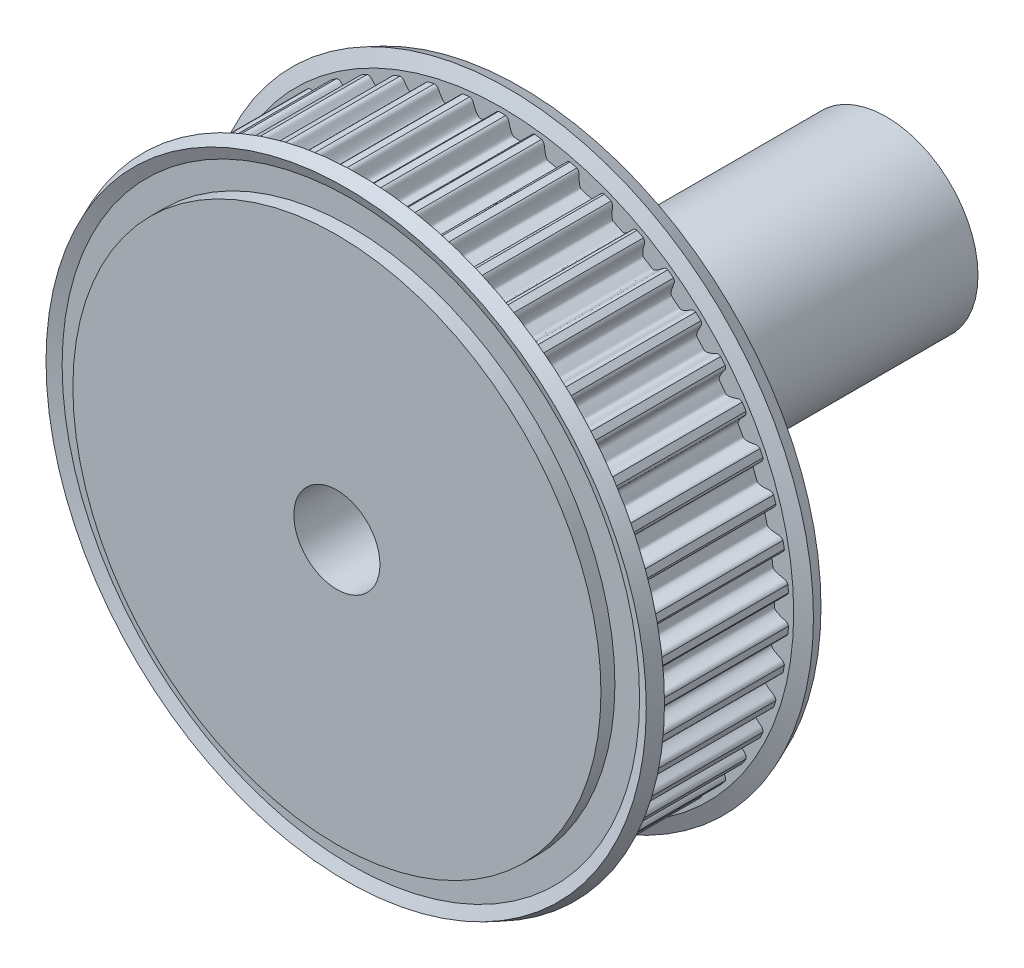
from build123d import *

# Parameters (mm, degrees)
TOOTHEXTRUDECUTGEARBELT01_DEPTH = 3.749999944
TOOTH_PATTERN_50_COUNT          = 50
BOREREVOLVESKETCH_W             = 10.547999842
BOREREVOLVESKETCH_H             = 5
SKETCH_5_R                      = 5
EXTRUDE_1_DEPTH                 = 10
SKETCH_6_R                      = 5
SKETCH_6_R_2                    = 2.5
EXTRUDE_2_DEPTH                 = 20
CUT_EXTRUDE_START               = -20
SKETCH_7_R                      = 2.5
CUT_EXTRUDE_2_DEPTH             = 20
CUT_EXTRUDE_3_DEPTH             = 20
SKETCH_9_R                      = 2.5
SKETCH_9_R_2                    = 2.35
EXTRUDE_3_DEPTH                 = 11
SKETCH_10_R                     = 2
CUT_EXTRUDE_4_DEPTH             = 11
SKETCH_12_R                     = 2
CUT_EXTRUDE_7_DEPTH             = 11


with BuildPart() as part:
    # SketchRevolveGearBelt01 → Gates_PowerGrip_GT_2mm, 6mm Belt Width (revolve)
    with BuildSketch(Plane(origin=(0, 0, 0), x_dir=(0, 0, -1), z_dir=(1, 0, 0))):
        Polygon((5.273999921, 0), (5.273999921, 14.415494093), (4.511999932, 14.415494093), (4.511999932, 15.763922848), (4.769626867, 16.385889288), (4.065630673, 16.677494059), (3.749999944, 15.91549407), (3.749999944, 15.646678254), (-3.749999944, 15.646678254), (-3.749999944, 15.91549407), (-4.065630673, 16.677494059), (-4.769626867, 16.385889288), (-4.511999932, 15.763922848), (-4.511999932, 14.415494093), (-5.273999921, 14.415494093), (-5.273999921, 0), align=None)
    revolve(axis=Axis((0, 0, 0), (0, 0, -1)))

    # SketchToothGearBelt01 → ToothExtrudeCutGearBelt01 (cut, symmetric)
    with BuildSketch(Plane.XY):
        with BuildLine():
            ThreePointArc((15.637376203, 0.861113256), (15.661067988, 0), (15.637376203, -0.861113256))
            add(Edge.make_bspline(
                [(15.637376203, -0.861113256), (15.637278933, -0.843918089), (15.634621947, -0.818141351), (15.626182662, -0.784761006), (15.61746536, -0.760453955), (15.606441353, -0.737102384), (15.593213806, -0.714924513), (15.577906271, -0.694127888), (15.560662121, -0.674906068), (15.541641534, -0.657441892), (15.521026112, -0.641886841), (15.498994385, -0.628430261), (15.475805238, -0.617033961), (15.434818262, -0.602515119), (15.382846813, -0.586823891), (15.321682454, -0.567481163), (15.269233172, -0.549825674), (15.219953565, -0.532186902), (15.173849403, -0.514546567), (15.130918186, -0.496909289), (15.091159139, -0.479273963), (15.05457066, -0.461640694), (15.02115084, -0.444008949), (14.990897185, -0.426377751), (14.963806669, -0.408745201), (14.939875464, -0.391107907), (14.91910027, -0.373460068), (14.901476198, -0.355792311), (14.887009705, -0.33809054), (14.875688939, -0.320336691), (14.867603066, -0.302512788), (14.862562303, -0.28461649), (14.860361058, -0.250312541), (14.863543325, -0.199994192), (14.86368738, -0.1333067), (14.864455912, -0.066656855), (14.864569984, 0), (14.864455912, 0.066656855), (14.86368738, 0.1333067), (14.863543325, 0.199994192), (14.860361058, 0.250312541), (14.862562303, 0.28461649), (14.867603066, 0.302512788), (14.875688939, 0.320336691), (14.887009705, 0.33809054), (14.901476198, 0.355792311), (14.91910027, 0.373460068), (14.939875464, 0.391107907), (14.963806669, 0.408745201), (14.990897185, 0.426377751), (15.02115084, 0.444008949), (15.05457066, 0.461640694), (15.091159139, 0.479273963), (15.130918186, 0.496909289), (15.173849403, 0.514546567), (15.219953565, 0.532186902), (15.269233172, 0.549825674), (15.321682454, 0.567481163), (15.382846813, 0.586823891), (15.434818262, 0.602515119), (15.475805238, 0.617033961), (15.498994385, 0.628430261), (15.521026112, 0.641886841), (15.541641534, 0.657441892), (15.560662121, 0.674906068), (15.577906271, 0.694127888), (15.593213806, 0.714924513), (15.606441353, 0.737102384), (15.61746536, 0.760453955), (15.626182662, 0.784761006), (15.634621947, 0.818141351), (15.637278933, 0.843918089), (15.637376203, 0.861113256)],
                knots=[0, 0, 0, 0, 0.019648851, 0.029473277, 0.039297703, 0.049122128, 0.058946554, 0.068770979, 0.078595405, 0.088419831, 0.098244256, 0.108068682, 0.117893108, 0.127717533, 0.157725567, 0.17996059, 0.201044693, 0.220984987, 0.239789879, 0.257469398, 0.274035615, 0.289503209, 0.303890223, 0.317219086, 0.329518021, 0.340822965, 0.351180206, 0.360649943, 0.369310898, 0.37726584, 0.38464709, 0.391619702, 0.398378739, 0.423802869, 0.449201913, 0.474600956, 0.5, 0.525399044, 0.550798087, 0.576197131, 0.601621261, 0.608380298, 0.61535291, 0.62273416, 0.630689102, 0.639350057, 0.648819794, 0.659177035, 0.670481979, 0.682780914, 0.696109777, 0.710496791, 0.725964385, 0.742530602, 0.760210121, 0.779015013, 0.798955307, 0.82003941, 0.842274433, 0.872282467, 0.882106892, 0.891931318, 0.901755744, 0.911580169, 0.921404595, 0.931229021, 0.941053446, 0.950877872, 0.960702297, 0.970526723, 0.980351149, 1, 1, 1, 1], degree=3))
        make_face()
    toothextrudecutgearbelt01 = extrude(amount=TOOTHEXTRUDECUTGEARBELT01_DEPTH, both=True, mode=Mode.SUBTRACT)

    # Tooth Pattern, 50: ToothExtrudeCutGearBelt01 ×50 about axis
    tooth_pattern_50_axis = Axis((0, 0, 55), (0, 0, -1))
    for i in range(1, TOOTH_PATTERN_50_COUNT):
        add(toothextrudecutgearbelt01.rotate(tooth_pattern_50_axis, i * 360 / TOOTH_PATTERN_50_COUNT), mode=Mode.SUBTRACT)

    # BoreRevolveSketch → BoreRevolveCut (revolve, cut)
    with BuildSketch(Plane(origin=(0, 0, 0), x_dir=(0, 0, -1), z_dir=(1, 0, 0))):
        with Locations((0, 2.5)):
            Rectangle(BOREREVOLVESKETCH_W, BOREREVOLVESKETCH_H)
    revolve(axis=Axis((0, 0, 0), (0, 0, -1)), mode=Mode.SUBTRACT)

    # 草图5 → 凸台-拉伸1 (add)
    with BuildSketch(Plane.XY.offset(5.273999921)):
        Circle(SKETCH_5_R)
    extrude(amount=-EXTRUDE_1_DEPTH)

    # 草图6 → 凸台-拉伸2 (add)
    with BuildSketch(Plane(origin=(0, 0, -4.726000079), x_dir=(-1, 0, 0), z_dir=(0, 0, -1))):
        Circle(SKETCH_6_R)
        Circle(SKETCH_6_R_2, mode=Mode.SUBTRACT)
    extrude(amount=EXTRUDE_2_DEPTH)

    # 草图7 → 切除-拉伸2 (cut)
    with BuildSketch(Plane(origin=(0, 0, -4.726000079), x_dir=(-1, 0, 0), z_dir=(0, 0, -1)).offset(CUT_EXTRUDE_START)):
        Circle(SKETCH_7_R)
    extrude(amount=CUT_EXTRUDE_2_DEPTH, mode=Mode.SUBTRACT)

    # 草图8 → 切除-拉伸3 (cut)
    with BuildSketch(Plane(origin=(0, 0, 0), x_dir=(1, 0, 0), z_dir=(0, 1, 0))):
        with BuildLine():
            ThreePointArc((0, 16.226000079), (-1.060660172, 13.665339907), (1.5, 14.726000079))
            ThreePointArc((1.5, 14.726000079), (1.060660172, 15.786660251), (0, 16.226000079))
        make_face()
    extrude(amount=-CUT_EXTRUDE_3_DEPTH, mode=Mode.SUBTRACT)

    # 草图9 → 凸台-拉伸3 (add)
    with BuildSketch(Plane.XY.offset(5.273999921)):
        Circle(SKETCH_9_R)
        Circle(SKETCH_9_R_2, mode=Mode.SUBTRACT)
    extrude(amount=-EXTRUDE_3_DEPTH)

    # 草图10 → 切除-拉伸4 (cut)
    with BuildSketch(Plane(origin=(0, 0, 0), x_dir=(0, 0, -1), z_dir=(1, 0, 0))):
        with Locations((14.726000079, 0)):
            Circle(SKETCH_10_R)
    extrude(amount=-CUT_EXTRUDE_4_DEPTH, mode=Mode.SUBTRACT)

    # 草图12 → 切除-拉伸7 (cut)
    with BuildSketch(Plane(origin=(0, 0, 0), x_dir=(1, 0, 0), z_dir=(0, 1, 0))):
        with Locations((0, 14.726000079)):
            Circle(SKETCH_12_R)
    extrude(amount=-CUT_EXTRUDE_7_DEPTH, mode=Mode.SUBTRACT)


solid = part.part
